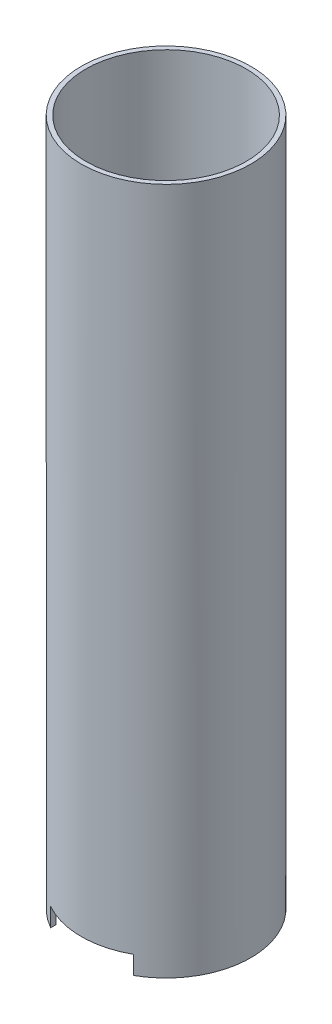
from build123d import *

# Parameters (mm, degrees)
SKETCH1_R          = 18.5
SKETCH1_R_2        = 17.5
SHELL_DEPTH        = 150
SKETCH8_R          = 17.5
SKETCH8_R_2        = 3.5
SKETCH8_R_3        = 5.55625
RODALIGNER_DEPTH   = 1
CUT_EXTRUDE1_DEPTH = 4


with BuildPart() as part:
    # Sketch1 → Shell (new body)
    with BuildSketch(Plane(origin=(0, 0, 0), x_dir=(1, 0, 0), z_dir=(0, 1, 0))):
        Circle(SKETCH1_R)
        Circle(SKETCH1_R_2, mode=Mode.SUBTRACT)
    extrude(amount=SHELL_DEPTH)

    # Sketch8 → RodAligner (add, symmetric)
    with BuildSketch(Plane(origin=(0, 120, 0), x_dir=(1, 0, 0), z_dir=(0, 1, 0))):
        Circle(SKETCH8_R)
        with Locations((0, -12)):
            Circle(SKETCH8_R_2, mode=Mode.SUBTRACT)
        Circle(SKETCH8_R_3, mode=Mode.SUBTRACT)
    extrude(amount=RODALIGNER_DEPTH, both=True)

    # Sketch1<7> → Cut-Extrude1 (cut)
    with BuildSketch(Plane(origin=(0, 0, 0), x_dir=(1, 0, 0), z_dir=(0, 1, 0))):
        with BuildLine():
            Line((-9.013878189, 16.155494421), (-9.013878189, 15))
            ThreePointArc((-9.013878189, 15), (0, 17.5), (9.013878189, 15))
            Line((9.013878189, 15), (9.013878189, 16.155494421))
            ThreePointArc((9.013878189, 16.155494421), (0, 18.5), (-9.013878189, 16.155494421))
        make_face()
        with BuildLine():
            ThreePointArc((9.013878189, -15), (0, -17.5), (-9.013878189, -15))
            Line((-9.013878189, -15), (-9.013878189, -16.155494421))
            ThreePointArc((-9.013878189, -16.155494421), (0, -18.5), (9.013878189, -16.155494421))
            Line((9.013878189, -16.155494421), (9.013878189, -15))
        make_face()
    extrude(amount=CUT_EXTRUDE1_DEPTH, mode=Mode.SUBTRACT)


solid = part.part
